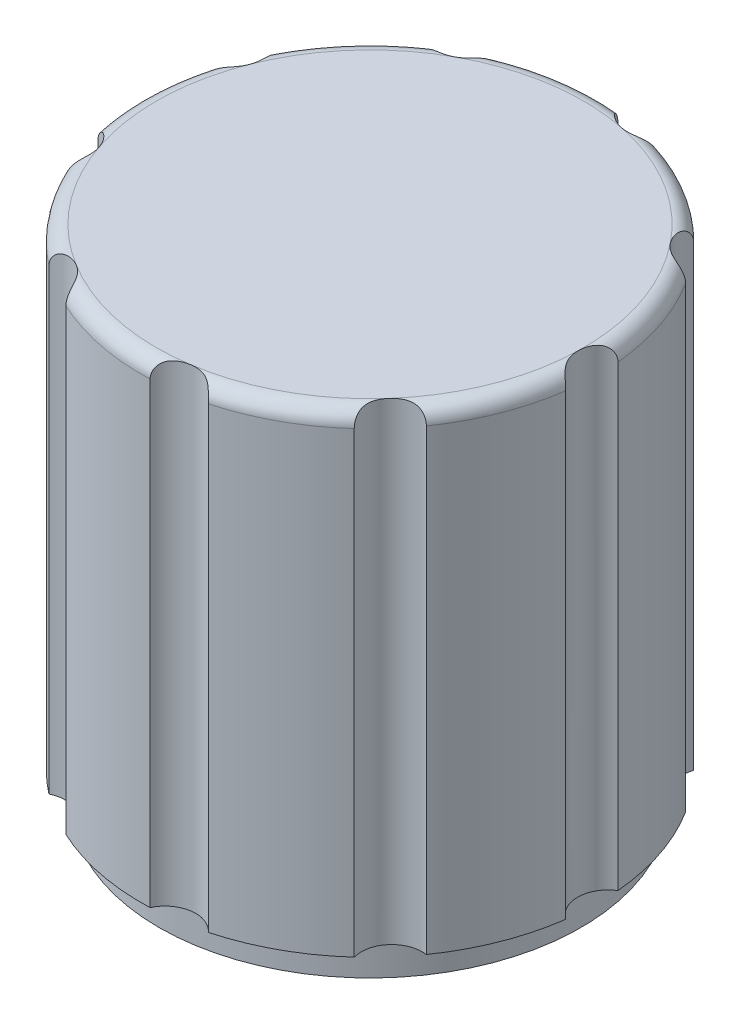
from build123d import *

# Parameters (mm, degrees)
SKETCH1_R           = 7.5
BOSS_EXTRUDE1_DEPTH = 16.5
FILLET1_R           = 0.5
SKETCH2_R           = 2.750419987
CUT_EXTRUDE1_DEPTH  = 5
SKETCH3_R           = 7.5
SKETCH3_R_2         = 6.914968151
CUT_EXTRUDE2_DEPTH  = 1
SKETCH4_R           = 1
CUT_EXTRUDE3_DEPTH  = 20.615045246


with BuildPart() as part:
    # Sketch1 → Boss-Extrude1 (new body)
    with BuildSketch(Plane(origin=(0, 0, 0), x_dir=(1, 0, 0), z_dir=(0, 1, 0))):
        Circle(SKETCH1_R)
    extrude(amount=BOSS_EXTRUDE1_DEPTH)

    # Fillet1
    fillet1_edges = [part.edges().sort_by_distance(p)[0] for p in [
        (-7.5, 16.5, 0),
    ]]
    fillet(fillet1_edges, radius=FILLET1_R)

    # Sketch2 → Cut-Extrude1 (cut)
    with BuildSketch(Plane.XZ):
        Circle(SKETCH2_R)
    extrude(amount=-CUT_EXTRUDE1_DEPTH, mode=Mode.SUBTRACT)

    # Sketch3 → Cut-Extrude2 (cut)
    with BuildSketch(Plane.XZ):
        Circle(SKETCH3_R)
        Circle(SKETCH3_R_2, mode=Mode.SUBTRACT)
    extrude(amount=-CUT_EXTRUDE2_DEPTH, mode=Mode.SUBTRACT)

    # Sketch4 → Cut-Extrude3 (cut, through all)
    with BuildSketch(Plane(origin=(0, 16.5, 0), x_dir=(1, 0, 0), z_dir=(0, 1, 0))):
        with Locations((1.198920421, -7.909651688)):
            Circle(SKETCH4_R)
        with Locations((-4.165799776, -6.829795914)):
            Circle(SKETCH4_R)
        with Locations((-7.58129596, -2.554202727)):
            Circle(SKETCH4_R)
        with Locations((-7.449419507, 2.916530302)):
            Circle(SKETCH4_R)
        with Locations((-3.831876876, 7.02258639)):
            Circle(SKETCH4_R)
        with Locations((1.578643531, 7.842696258)):
            Circle(SKETCH4_R)
        with Locations((6.250499086, 4.993121386)):
            Circle(SKETCH4_R)
        with Locations((7.997676652, -0.192790476)):
            Circle(SKETCH4_R)
        with Locations((6.002652428, -5.288493531)):
            Circle(SKETCH4_R)
    extrude(amount=-CUT_EXTRUDE3_DEPTH, mode=Mode.SUBTRACT)


solid = part.part
